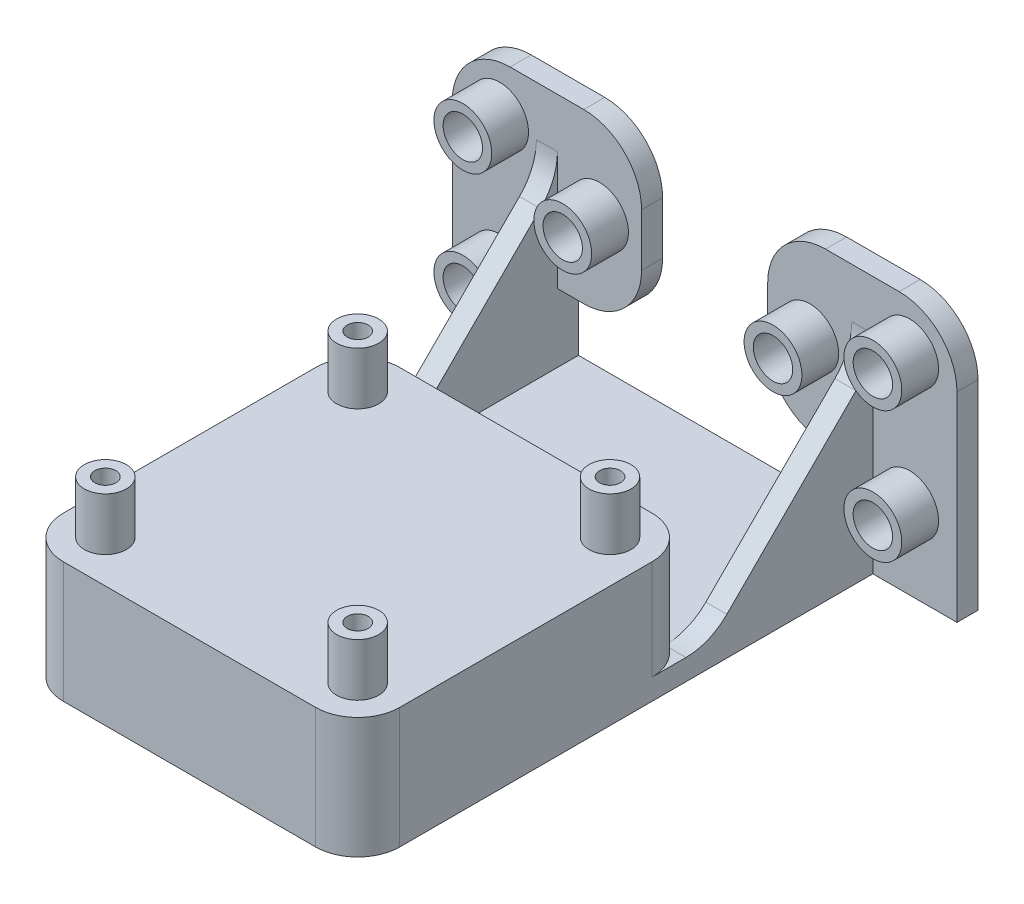
from build123d import *

# Parameters (mm, degrees)
SKETCH1_R            = 2
BOSS_EXTRUDE1_DEPTH  = 20
CUT_EXTRUDE3_DEPTH   = 2.5
CUT_EXTRUDE4_DEPTH   = 3.5
BOSS_EXTRUDE6_START  = 20
SKETCH1_6_R          = 20
SKETCH1_6_R_2        = 16
SKETCH1_6_R_3        = 6.1
SKETCH1_6_R_4        = 1.5
SKETCH1_6_R_5        = 2
BOSS_EXTRUDE6_DEPTH  = 3
BOSS_EXTRUDE7_DEPTH  = 4
BOSS_EXTRUDE11_DEPTH = 4
SKETCH3_3_W          = 4
SKETCH3_3_H          = 49
BOSS_EXTRUDE12_DEPTH = 16
SKETCH3_4_W          = 4
SKETCH3_4_H          = 6
BOSS_EXTRUDE13_DEPTH = 20
FILLET2_R            = 11
SKETCH4_R            = 5.5
SKETCH4_R_2          = 3.75
BOSS_EXTRUDE14_DEPTH = 7
CUT_EXTRUDE5_START   = -7
SKETCH4_3_R          = 3.75
CUT_EXTRUDE5_DEPTH   = 7
FILLET2_OF_MIRROR2_R = 11
FILLET3_R            = 11
BOSS_EXTRUDE15_START = 23
SKETCH5_R            = 4
SKETCH5_R_2          = 2
BOSS_EXTRUDE15_DEPTH = 10
SKETCH5_2_R          = 2
CUT_EXTRUDE6_DEPTH   = 90


with BuildPart() as part:
    # Sketch1 → Boss-Extrude1 (new body)
    # profile 1 of 6: a face of its own
    with BuildSketch(Plane(origin=(0, 0, 0), x_dir=(1, 0, 0), z_dir=(0, 1, 0))):
        with BuildLine():
            Line((32, -24), (32, 24))
            ThreePointArc((32, 24), (29.656854249, 29.656854249), (24, 32))
            Line((24, 32), (-24, 32))
            ThreePointArc((-24, 32), (-29.656854249, 29.656854249), (-32, 24))
            Line((-32, 24), (-32, -24))
            ThreePointArc((-32, -24), (-29.656854249, -29.656854249), (-24, -32))
            Line((-24, -32), (24, -32))
            ThreePointArc((24, -32), (29.656854249, -29.656854249), (32, -24))
        make_face()
        with BuildLine():
            ThreePointArc((-30, 24), (-28.242640687, 28.242640687), (-24, 30))
            Line((-24, 30), (24, 30))
            ThreePointArc((24, 30), (28.242640687, 28.242640687), (30, 24))
            Line((30, 24), (30, -24))
            ThreePointArc((30, -24), (28.242640687, -28.242640687), (24, -30))
            Line((24, -30), (-24, -30))
            ThreePointArc((-24, -30), (-28.242640687, -28.242640687), (-30, -24))
            Line((-30, -24), (-30, 24))
        make_face(mode=Mode.SUBTRACT)
    # profile 2 of 6: a face of its own
    with BuildSketch(Plane(origin=(0, 0, 0), x_dir=(1, 0, 0), z_dir=(0, 1, 0))):
        with BuildLine():
            Line((24, 30), (-24, 30))
            ThreePointArc((-24, 30), (-28.242640687, 28.242640687), (-30, 24))
            Line((-30, 24), (-30, -24))
            ThreePointArc((-30, -24), (-28.242640687, -28.242640687), (-24, -30))
            Line((-24, -30), (24, -30))
            ThreePointArc((24, -30), (28.242640687, -28.242640687), (30, -24))
            Line((30, -24), (30, 24))
            ThreePointArc((30, 24), (28.242640687, 28.242640687), (24, 30))
        make_face()
        with BuildLine():
            Line((-28, 20), (-28, 24))
            ThreePointArc((-28, 24), (-26.828427125, 26.828427125), (-24, 28))
            Line((-24, 28), (-20, 28))
            Line((-20, 28), (20, 28))
            Line((20, 28), (24, 28))
            ThreePointArc((24, 28), (26.828427125, 26.828427125), (28, 24))
            Line((28, 24), (28, 20))
            Line((28, 20), (28, -20))
            Line((28, -20), (28, -24))
            ThreePointArc((28, -24), (26.828427125, -26.828427125), (24, -28))
            Line((24, -28), (20, -28))
            Line((20, -28), (-20, -28))
            Line((-20, -28), (-24, -28))
            ThreePointArc((-24, -28), (-26.828427125, -26.828427125), (-28, -24))
            Line((-28, -24), (-28, -20))
            Line((-28, -20), (-28, 20))
        make_face(mode=Mode.SUBTRACT)
    # profile 3 of 6: a face of its own
    with BuildSketch(Plane(origin=(0, 0, 0), x_dir=(1, 0, 0), z_dir=(0, 1, 0))):
        with BuildLine():
            Line((-24, -20), (-28, -20))
            Line((-28, -20), (-28, -24))
            ThreePointArc((-28, -24), (-26.828427125, -26.828427125), (-24, -28))
            Line((-24, -28), (-20, -28))
            Line((-20, -28), (-20, -24))
            ThreePointArc((-20, -24), (-21.171572875, -21.171572875), (-24, -20))
        make_face()
        with Locations(Location((-24, -24, 0), (0, 0, 270))):
            Circle(SKETCH1_R, mode=Mode.SUBTRACT)
    # profile 4 of 6: a face of its own
    with BuildSketch(Plane(origin=(0, 0, 0), x_dir=(1, 0, 0), z_dir=(0, 1, 0))):
        with BuildLine():
            Line((20, -24), (20, -28))
            Line((20, -28), (24, -28))
            ThreePointArc((24, -28), (26.828427125, -26.828427125), (28, -24))
            Line((28, -24), (28, -20))
            Line((28, -20), (24, -20))
            ThreePointArc((24, -20), (21.171572875, -21.171572875), (20, -24))
        make_face()
        with Locations(Location((24, -24, 0), (0, 0, 270))):
            Circle(SKETCH1_R, mode=Mode.SUBTRACT)
    # profile 5 of 6: a face of its own
    with BuildSketch(Plane(origin=(0, 0, 0), x_dir=(1, 0, 0), z_dir=(0, 1, 0))):
        with BuildLine():
            Line((24, 28), (20, 28))
            Line((20, 28), (20, 24))
            ThreePointArc((20, 24), (21.171572875, 21.171572875), (24, 20))
            Line((24, 20), (28, 20))
            Line((28, 20), (28, 24))
            ThreePointArc((28, 24), (26.828427125, 26.828427125), (24, 28))
        make_face()
        with Locations(Location((24, 24, 0), (0, 0, 270))):
            Circle(SKETCH1_R, mode=Mode.SUBTRACT)
    # profile 6 of 6: a face of its own
    with BuildSketch(Plane(origin=(0, 0, 0), x_dir=(1, 0, 0), z_dir=(0, 1, 0))):
        with BuildLine():
            ThreePointArc((-24, 28), (-26.828427125, 26.828427125), (-28, 24))
            Line((-28, 24), (-28, 20))
            Line((-28, 20), (-24, 20))
            ThreePointArc((-24, 20), (-21.171572875, 21.171572875), (-20, 24))
            Line((-20, 24), (-20, 28))
            Line((-20, 28), (-24, 28))
        make_face()
        with Locations(Location((-24, 24, 0), (0, 0, 270))):
            Circle(SKETCH1_R, mode=Mode.SUBTRACT)
    extrude(amount=BOSS_EXTRUDE1_DEPTH)

    # Sketch1<4> → Cut-Extrude3 (cut)
    with BuildSketch(Plane(origin=(0, 0, 0), x_dir=(1, 0, 0), z_dir=(0, 1, 0))):
        with BuildLine():
            Line((-24, 30), (24, 30))
            ThreePointArc((24, 30), (28.242640687, 28.242640687), (30, 24))
            Line((30, 24), (30, -24))
            ThreePointArc((30, -24), (28.242640687, -28.242640687), (24, -30))
            Line((24, -30), (-24, -30))
            ThreePointArc((-24, -30), (-28.242640687, -28.242640687), (-30, -24))
            Line((-30, -24), (-30, 24))
            ThreePointArc((-30, 24), (-28.242640687, 28.242640687), (-24, 30))
        make_face()
        with BuildLine():
            Line((-28, 24), (-28, -24))
            ThreePointArc((-28, -24), (-26.828427125, -26.828427125), (-24, -28))
            Line((-24, -28), (24, -28))
            ThreePointArc((24, -28), (26.828427125, -26.828427125), (28, -24))
            Line((28, -24), (28, 24))
            ThreePointArc((28, 24), (26.828427125, 26.828427125), (24, 28))
            Line((24, 28), (-24, 28))
            ThreePointArc((-24, 28), (-26.828427125, 26.828427125), (-28, 24))
        make_face(mode=Mode.SUBTRACT)
    extrude(amount=CUT_EXTRUDE3_DEPTH, mode=Mode.SUBTRACT)

    # Sketch1<5> → Cut-Extrude4 (cut)
    with BuildSketch(Plane(origin=(0, 0, 0), x_dir=(1, 0, 0), z_dir=(0, 1, 0))):
        with BuildLine():
            Line((-28, 24), (-28, -24))
            ThreePointArc((-28, -24), (-26.828427125, -26.828427125), (-24, -28))
            Line((-24, -28), (24, -28))
            ThreePointArc((24, -28), (26.828427125, -26.828427125), (28, -24))
            Line((28, -24), (28, 24))
            ThreePointArc((28, 24), (26.828427125, 26.828427125), (24, 28))
            Line((24, 28), (-24, 28))
            ThreePointArc((-24, 28), (-26.828427125, 26.828427125), (-28, 24))
        make_face()
    extrude(amount=CUT_EXTRUDE4_DEPTH, mode=Mode.SUBTRACT)

    # Sketch1<6> → Boss-Extrude6 (add)
    # profile 1 of 22: a face of its own
    with BuildSketch(Plane(origin=(0, 0, 0), x_dir=(1, 0, 0), z_dir=(0, 1, 0)).offset(BOSS_EXTRUDE6_START)):
        with BuildLine():
            Line((32, -24), (32, 24))
            ThreePointArc((32, 24), (29.656854249, 29.656854249), (24, 32))
            Line((24, 32), (-24, 32))
            ThreePointArc((-24, 32), (-29.656854249, 29.656854249), (-32, 24))
            Line((-32, 24), (-32, -24))
            ThreePointArc((-32, -24), (-29.656854249, -29.656854249), (-24, -32))
            Line((-24, -32), (24, -32))
            ThreePointArc((24, -32), (29.656854249, -29.656854249), (32, -24))
        make_face()
        with BuildLine():
            ThreePointArc((-30, 24), (-28.242640687, 28.242640687), (-24, 30))
            Line((-24, 30), (24, 30))
            ThreePointArc((24, 30), (28.242640687, 28.242640687), (30, 24))
            Line((30, 24), (30, -24))
            ThreePointArc((30, -24), (28.242640687, -28.242640687), (24, -30))
            Line((24, -30), (-24, -30))
            ThreePointArc((-24, -30), (-28.242640687, -28.242640687), (-30, -24))
            Line((-30, -24), (-30, 24))
        make_face(mode=Mode.SUBTRACT)
    # profile 2 of 22: a face of its own
    with BuildSketch(Plane(origin=(0, 0, 0), x_dir=(1, 0, 0), z_dir=(0, 1, 0)).offset(BOSS_EXTRUDE6_START)):
        with BuildLine():
            Line((24, 30), (-24, 30))
            ThreePointArc((-24, 30), (-28.242640687, 28.242640687), (-30, 24))
            Line((-30, 24), (-30, -24))
            ThreePointArc((-30, -24), (-28.242640687, -28.242640687), (-24, -30))
            Line((-24, -30), (24, -30))
            ThreePointArc((24, -30), (28.242640687, -28.242640687), (30, -24))
            Line((30, -24), (30, 24))
            ThreePointArc((30, 24), (28.242640687, 28.242640687), (24, 30))
        make_face()
        with BuildLine():
            Line((-28, 20), (-28, 24))
            ThreePointArc((-28, 24), (-26.828427125, 26.828427125), (-24, 28))
            Line((-24, 28), (-20, 28))
            Line((-20, 28), (20, 28))
            Line((20, 28), (24, 28))
            ThreePointArc((24, 28), (26.828427125, 26.828427125), (28, 24))
            Line((28, 24), (28, 20))
            Line((28, 20), (28, -20))
            Line((28, -20), (28, -24))
            ThreePointArc((28, -24), (26.828427125, -26.828427125), (24, -28))
            Line((24, -28), (20, -28))
            Line((20, -28), (-20, -28))
            Line((-20, -28), (-24, -28))
            ThreePointArc((-24, -28), (-26.828427125, -26.828427125), (-28, -24))
            Line((-28, -24), (-28, -20))
            Line((-28, -20), (-28, 20))
        make_face(mode=Mode.SUBTRACT)
    # profile 3 of 22: a face of its own
    with BuildSketch(Plane(origin=(0, 0, 0), x_dir=(1, 0, 0), z_dir=(0, 1, 0)).offset(BOSS_EXTRUDE6_START)):
        with BuildLine():
            Line((-24, 20), (-28, 20))
            Line((-28, 20), (-28, -20))
            Line((-28, -20), (-24, -20))
            ThreePointArc((-24, -20), (-21.171572875, -21.171572875), (-20, -24))
            Line((-20, -24), (-20, -28))
            Line((-20, -28), (20, -28))
            Line((20, -28), (20, -24))
            ThreePointArc((20, -24), (21.171572875, -21.171572875), (24, -20))
            Line((24, -20), (28, -20))
            Line((28, -20), (28, 20))
            Line((28, 20), (24, 20))
            ThreePointArc((24, 20), (21.171572875, 21.171572875), (20, 24))
            Line((20, 24), (20, 28))
            Line((20, 28), (-20, 28))
            Line((-20, 28), (-20, 24))
            ThreePointArc((-20, 24), (-21.171572875, 21.171572875), (-24, 20))
        make_face()
        with BuildLine():
            ThreePointArc((2.732186624, 19.8125), (14.142135624, 14.142135624), (19.8125, 2.732186624))
            ThreePointArc((19.8125, 2.732186624), (25.5, 0), (19.8125, -2.732186624))
            ThreePointArc((19.8125, -2.732186624), (14.142135624, -14.142135624), (2.732186624, -19.8125))
            ThreePointArc((2.732186624, -19.8125), (0, -25.5), (-2.732186624, -19.8125))
            ThreePointArc((-2.732186624, -19.8125), (-14.142135624, -14.142135624), (-19.8125, -2.732186624))
            ThreePointArc((-19.8125, -2.732186624), (-25.5, 0), (-19.8125, 2.732186624))
            ThreePointArc((-19.8125, 2.732186624), (-14.142135624, 14.142135624), (-2.732186624, 19.8125))
            ThreePointArc((-2.732186624, 19.8125), (0, 25.5), (2.732186624, 19.8125))
        make_face(mode=Mode.SUBTRACT)
    # profile 4 of 22: a face of its own
    with BuildSketch(Plane(origin=(0, 0, 0), x_dir=(1, 0, 0), z_dir=(0, 1, 0)).offset(BOSS_EXTRUDE6_START)):
        Circle(SKETCH1_6_R)
        Circle(SKETCH1_6_R_2, mode=Mode.SUBTRACT)
    # profile 5 of 22: a face of its own
    with BuildSketch(Plane(origin=(0, 0, 0), x_dir=(1, 0, 0), z_dir=(0, 1, 0)).offset(BOSS_EXTRUDE6_START)):
        Circle(SKETCH1_6_R_2)
        Circle(SKETCH1_6_R_3, mode=Mode.SUBTRACT)
    # profile 6 of 22: a face of its own
    with BuildSketch(Plane(origin=(0, 0, 0), x_dir=(1, 0, 0), z_dir=(0, 1, 0)).offset(BOSS_EXTRUDE6_START)):
        with BuildLine():
            ThreePointArc((-19.8125, -2.732186624), (-20, 0), (-19.8125, 2.732186624))
            ThreePointArc((-19.8125, 2.732186624), (-25.5, 0), (-19.8125, -2.732186624))
        make_face()
        with Locations((-22, 0)):
            Circle(SKETCH1_6_R_4, mode=Mode.SUBTRACT)
    # profile 7 of 22: a face of its own
    with BuildSketch(Plane(origin=(0, 0, 0), x_dir=(1, 0, 0), z_dir=(0, 1, 0)).offset(BOSS_EXTRUDE6_START)):
        with Locations((-22, 0)):
            Circle(SKETCH1_6_R_4)
    # profile 8 of 22: a face of its own
    with BuildSketch(Plane(origin=(0, 0, 0), x_dir=(1, 0, 0), z_dir=(0, 1, 0)).offset(BOSS_EXTRUDE6_START)):
        with BuildLine():
            ThreePointArc((-2.732186624, -19.8125), (0, -25.5), (2.732186624, -19.8125))
            ThreePointArc((2.732186624, -19.8125), (0, -20), (-2.732186624, -19.8125))
        make_face()
        with Locations((0, -22)):
            Circle(SKETCH1_6_R_4, mode=Mode.SUBTRACT)
    # profile 9 of 22: a face of its own
    with BuildSketch(Plane(origin=(0, 0, 0), x_dir=(1, 0, 0), z_dir=(0, 1, 0)).offset(BOSS_EXTRUDE6_START)):
        with Locations((0, -22)):
            Circle(SKETCH1_6_R_4)
    # profile 10 of 22: a face of its own
    with BuildSketch(Plane(origin=(0, 0, 0), x_dir=(1, 0, 0), z_dir=(0, 1, 0)).offset(BOSS_EXTRUDE6_START)):
        with BuildLine():
            ThreePointArc((19.8125, 2.732186624), (19.953069939, 1.369306394), (20, 0))
            ThreePointArc((20, 0), (19.953069939, -1.369306394), (19.8125, -2.732186624))
            ThreePointArc((19.8125, -2.732186624), (25.5, 0), (19.8125, 2.732186624))
        make_face()
        with Locations((22, 0)):
            Circle(SKETCH1_6_R_4, mode=Mode.SUBTRACT)
    # profile 11 of 22: a face of its own
    with BuildSketch(Plane(origin=(0, 0, 0), x_dir=(1, 0, 0), z_dir=(0, 1, 0)).offset(BOSS_EXTRUDE6_START)):
        with Locations((22, 0)):
            Circle(SKETCH1_6_R_4)
    # profile 12 of 22: a face of its own
    with BuildSketch(Plane(origin=(0, 0, 0), x_dir=(1, 0, 0), z_dir=(0, 1, 0)).offset(BOSS_EXTRUDE6_START)):
        with BuildLine():
            ThreePointArc((-2.732186624, 19.8125), (0, 20), (2.732186624, 19.8125))
            ThreePointArc((2.732186624, 19.8125), (0, 25.5), (-2.732186624, 19.8125))
        make_face()
        with Locations((0, 22)):
            Circle(SKETCH1_6_R_4, mode=Mode.SUBTRACT)
    # profile 13 of 22: a face of its own
    with BuildSketch(Plane(origin=(0, 0, 0), x_dir=(1, 0, 0), z_dir=(0, 1, 0)).offset(BOSS_EXTRUDE6_START)):
        with Locations((0, 22)):
            Circle(SKETCH1_6_R_4)
    # profile 14 of 22: a face of its own
    with BuildSketch(Plane(origin=(0, 0, 0), x_dir=(1, 0, 0), z_dir=(0, 1, 0)).offset(BOSS_EXTRUDE6_START)):
        with BuildLine():
            Line((20, -24), (20, -28))
            Line((20, -28), (24, -28))
            ThreePointArc((24, -28), (26.828427125, -26.828427125), (28, -24))
            Line((28, -24), (28, -20))
            Line((28, -20), (24, -20))
            ThreePointArc((24, -20), (21.171572875, -21.171572875), (20, -24))
        make_face()
        with Locations(Location((24, -24, 0), (0, 0, 270))):
            Circle(SKETCH1_6_R_5, mode=Mode.SUBTRACT)
    # profile 15 of 22: a face of its own
    with BuildSketch(Plane(origin=(0, 0, 0), x_dir=(1, 0, 0), z_dir=(0, 1, 0)).offset(BOSS_EXTRUDE6_START)):
        with Locations(Location((24, -24, 0), (0, 0, 270))):
            Circle(SKETCH1_6_R_5)
    # profile 16 of 22: a face of its own
    with BuildSketch(Plane(origin=(0, 0, 0), x_dir=(1, 0, 0), z_dir=(0, 1, 0)).offset(BOSS_EXTRUDE6_START)):
        with BuildLine():
            Line((24, 28), (20, 28))
            Line((20, 28), (20, 24))
            ThreePointArc((20, 24), (21.171572875, 21.171572875), (24, 20))
            Line((24, 20), (28, 20))
            Line((28, 20), (28, 24))
            ThreePointArc((28, 24), (26.828427125, 26.828427125), (24, 28))
        make_face()
        with Locations(Location((24, 24, 0), (0, 0, 270))):
            Circle(SKETCH1_6_R_5, mode=Mode.SUBTRACT)
    # profile 17 of 22: a face of its own
    with BuildSketch(Plane(origin=(0, 0, 0), x_dir=(1, 0, 0), z_dir=(0, 1, 0)).offset(BOSS_EXTRUDE6_START)):
        with Locations(Location((24, 24, 0), (0, 0, 270))):
            Circle(SKETCH1_6_R_5)
    # profile 18 of 22: a face of its own
    with BuildSketch(Plane(origin=(0, 0, 0), x_dir=(1, 0, 0), z_dir=(0, 1, 0)).offset(BOSS_EXTRUDE6_START)):
        with BuildLine():
            ThreePointArc((-24, 28), (-26.828427125, 26.828427125), (-28, 24))
            Line((-28, 24), (-28, 20))
            Line((-28, 20), (-24, 20))
            ThreePointArc((-24, 20), (-21.171572875, 21.171572875), (-20, 24))
            Line((-20, 24), (-20, 28))
            Line((-20, 28), (-24, 28))
        make_face()
        with Locations(Location((-24, 24, 0), (0, 0, 270))):
            Circle(SKETCH1_6_R_5, mode=Mode.SUBTRACT)
    # profile 19 of 22: a face of its own
    with BuildSketch(Plane(origin=(0, 0, 0), x_dir=(1, 0, 0), z_dir=(0, 1, 0)).offset(BOSS_EXTRUDE6_START)):
        with Locations(Location((-24, 24, 0), (0, 0, 270))):
            Circle(SKETCH1_6_R_5)
    # profile 20 of 22: a face of its own
    with BuildSketch(Plane(origin=(0, 0, 0), x_dir=(1, 0, 0), z_dir=(0, 1, 0)).offset(BOSS_EXTRUDE6_START)):
        with BuildLine():
            Line((-24, -20), (-28, -20))
            Line((-28, -20), (-28, -24))
            ThreePointArc((-28, -24), (-26.828427125, -26.828427125), (-24, -28))
            Line((-24, -28), (-20, -28))
            Line((-20, -28), (-20, -24))
            ThreePointArc((-20, -24), (-21.171572875, -21.171572875), (-24, -20))
        make_face()
        with Locations(Location((-24, -24, 0), (0, 0, 270))):
            Circle(SKETCH1_6_R_5, mode=Mode.SUBTRACT)
    # profile 21 of 22: a face of its own
    with BuildSketch(Plane(origin=(0, 0, 0), x_dir=(1, 0, 0), z_dir=(0, 1, 0)).offset(BOSS_EXTRUDE6_START)):
        with Locations(Location((-24, -24, 0), (0, 0, 270))):
            Circle(SKETCH1_6_R_5)
    # profile 22 of 22: a face of its own
    with BuildSketch(Plane(origin=(0, 0, 0), x_dir=(1, 0, 0), z_dir=(0, 1, 0)).offset(BOSS_EXTRUDE6_START)):
        Circle(SKETCH1_6_R_3)
    extrude(amount=BOSS_EXTRUDE6_DEPTH)

    # Sketch1<7> → Boss-Extrude7 (add)
    with BuildSketch(Plane(origin=(0, 0, 0), x_dir=(1, 0, 0), z_dir=(0, 1, 0))):
        with BuildLine():
            ThreePointArc((-24, 32), (-29.656854249, 29.656854249), (-32, 24))
            Line((-32, 24), (-32, 70))
            Line((-32, 70), (32, 70))
            Line((32, 70), (32, 24))
            ThreePointArc((32, 24), (29.656854249, 29.656854249), (24, 32))
            Line((24, 32), (-24, 32))
        make_face()
    extrude(amount=BOSS_EXTRUDE7_DEPTH)

    # Sketch3 → Boss-Extrude11 (add)
    with BuildSketch(Plane.ZY.offset(32)):
        Polygon((-35, 4), (-66, 35), (-66, 49), (-70, 49), (-70, 4), align=None)
    boss_extrude11 = extrude(amount=-BOSS_EXTRUDE11_DEPTH)

    # Sketch3<3> → Boss-Extrude12 (add)
    with BuildSketch(Plane.ZY.offset(32)):
        with Locations((-68, 24.5)):
            Rectangle(SKETCH3_3_W, SKETCH3_3_H)
    boss_extrude12 = extrude(amount=BOSS_EXTRUDE12_DEPTH)

    # Sketch3<4> → Boss-Extrude13 (add)
    with BuildSketch(Plane.ZY.offset(32)):
        Polygon((-66, 23), (-66, 35), (-66, 49), (-70, 49), (-70, 23), align=None)
        with Locations((-68, 20)):
            Rectangle(SKETCH3_4_W, SKETCH3_4_H)
    boss_extrude13 = extrude(amount=-BOSS_EXTRUDE13_DEPTH)

    # Fillet2
    fillet2_edges = [part.edges().sort_by_distance(p)[0] for p in [
        (-48, 49, -68),
        (-12, 17, -68),
        (-12, 49, -68),
    ]]
    fillet(fillet2_edges, radius=FILLET2_R)

    # Sketch4 → Boss-Extrude14 (add)
    # profile 1 of 3: a face of its own
    with BuildSketch(Plane.XY.offset(-66)):
        with Locations(Location((-39, 40, 0), (0, 0, 180))):
            Circle(SKETCH4_R)
        with Locations((-39, 40)):
            Circle(SKETCH4_R_2, mode=Mode.SUBTRACT)
    # profile 2 of 3: a face of its own
    with BuildSketch(Plane.XY.offset(-66)):
        with Locations(Location((-20, 33, 0), (0, 0, 180))):
            Circle(SKETCH4_R)
        with Locations((-20, 33)):
            Circle(SKETCH4_R_2, mode=Mode.SUBTRACT)
    # profile 3 of 3: a face of its own
    with BuildSketch(Plane.XY.offset(-66)):
        with Locations(Location((-39, 15, 0), (0, 0, 180))):
            Circle(SKETCH4_R)
        with Locations((-39, 15)):
            Circle(SKETCH4_R_2, mode=Mode.SUBTRACT)
    boss_extrude14 = extrude(amount=BOSS_EXTRUDE14_DEPTH)

    # Sketch4<3> → Cut-Extrude5 (cut)
    with BuildSketch(Plane.XY.offset(-66).offset(CUT_EXTRUDE5_START)):
        with Locations((-39, 40)):
            Circle(SKETCH4_3_R)
        with Locations((-39, 15)):
            Circle(SKETCH4_3_R)
        with Locations((-20, 33)):
            Circle(SKETCH4_3_R)
    cut_extrude5 = extrude(amount=CUT_EXTRUDE5_DEPTH, mode=Mode.SUBTRACT)

    # Mirror2: Boss-Extrude11, Boss-Extrude12, Boss-Extrude13, Boss-Extrude14, Cut-Extrude5 across plane
    add(boss_extrude11.mirror(Plane.ZY))
    add(boss_extrude12.mirror(Plane.ZY))
    add(boss_extrude13.mirror(Plane.ZY))
    add(boss_extrude14.mirror(Plane.ZY))
    add(cut_extrude5.mirror(Plane.ZY), mode=Mode.SUBTRACT)

    # Fillet2 of Mirror2
    fillet2_of_mirror2_edges = [part.edges().sort_by_distance(p)[0] for p in [
        (48, 49, -68),
        (12, 17, -68),
        (12, 49, -68),
    ]]
    fillet(fillet2_of_mirror2_edges, radius=FILLET2_OF_MIRROR2_R)

    # Fillet3
    # the kernel refuses this fillet: 11 mm, written as the material it adds along each edge
    with BuildSketch(Plane(origin=(-32, 35, -66), x_dir=(0, 1, 0), z_dir=(1, 0, 0)), Plane(origin=(32, 4, -35), x_dir=(0, 0, 1), z_dir=(-1, 0, 0))) as fillet3_piece_1:
        with BuildLine():
            CenterArc((FILLET3_R * 0.414213562373, FILLET3_R), FILLET3_R, 225, 45)
            Line((-FILLET3_R * 0.292893218813, FILLET3_R * 0.292893218813), (0, 0))
            Line((0, 0), (FILLET3_R * 0.414213562373, 0))
        make_face()
    extrude(amount=4)
    with BuildSketch(Plane(origin=(-32, 4, -35), x_dir=(0, 0, 1), z_dir=(1, 0, 0)), Plane(origin=(32, 35, -66), x_dir=(0, 1, 0), z_dir=(-1, 0, 0))) as fillet3_piece_2:
        with BuildLine():
            CenterArc((FILLET3_R * 0.414213562373, -FILLET3_R), FILLET3_R, 90, 45)
            Line((-FILLET3_R * 0.292893218813, -FILLET3_R * 0.292893218813), (0, 0))
            Line((0, 0), (FILLET3_R * 0.414213562373, 0))
        make_face()
    extrude(amount=4)

    # Sketch5 → Boss-Extrude15 (add)
    # profile 1 of 4: a face of its own
    with BuildSketch(Plane(origin=(0, 0, 0), x_dir=(1, 0, 0), z_dir=(0, 1, 0)).offset(BOSS_EXTRUDE15_START)):
        with Locations(Location((-24, 24, 0), (0, 0, 270))):
            Circle(SKETCH5_R)
        with Locations(Location((-24, 24, 0), (0, 0, 270))):
            Circle(SKETCH5_R_2, mode=Mode.SUBTRACT)
    # profile 2 of 4: a face of its own
    with BuildSketch(Plane(origin=(0, 0, 0), x_dir=(1, 0, 0), z_dir=(0, 1, 0)).offset(BOSS_EXTRUDE15_START)):
        with Locations(Location((24, 24, 0), (0, 0, 270))):
            Circle(SKETCH5_R)
        with Locations(Location((24, 24, 0), (0, 0, 270))):
            Circle(SKETCH5_R_2, mode=Mode.SUBTRACT)
    # profile 3 of 4: a face of its own
    with BuildSketch(Plane(origin=(0, 0, 0), x_dir=(1, 0, 0), z_dir=(0, 1, 0)).offset(BOSS_EXTRUDE15_START)):
        with Locations(Location((-24, -24, 0), (0, 0, 270))):
            Circle(SKETCH5_R)
        with Locations(Location((-24, -24, 0), (0, 0, 270))):
            Circle(SKETCH5_R_2, mode=Mode.SUBTRACT)
    # profile 4 of 4: a face of its own
    with BuildSketch(Plane(origin=(0, 0, 0), x_dir=(1, 0, 0), z_dir=(0, 1, 0)).offset(BOSS_EXTRUDE15_START)):
        with Locations(Location((24, -24, 0), (0, 0, 270))):
            Circle(SKETCH5_R)
        with Locations(Location((24, -24, 0), (0, 0, 270))):
            Circle(SKETCH5_R_2, mode=Mode.SUBTRACT)
    extrude(amount=BOSS_EXTRUDE15_DEPTH)

    # Sketch5<2> → Cut-Extrude6 (cut)
    with BuildSketch(Plane(origin=(0, 0, 0), x_dir=(1, 0, 0), z_dir=(0, 1, 0))):
        with Locations(Location((-24, -24, 0), (0, 0, 270))):
            Circle(SKETCH5_2_R)
        with Locations(Location((24, -24, 0), (0, 0, 270))):
            Circle(SKETCH5_2_R)
        with Locations(Location((-24, 24, 0), (0, 0, 270))):
            Circle(SKETCH5_2_R)
        with Locations(Location((24, 24, 0), (0, 0, 270))):
            Circle(SKETCH5_2_R)
    extrude(amount=CUT_EXTRUDE6_DEPTH, mode=Mode.SUBTRACT)


solid = part.part
